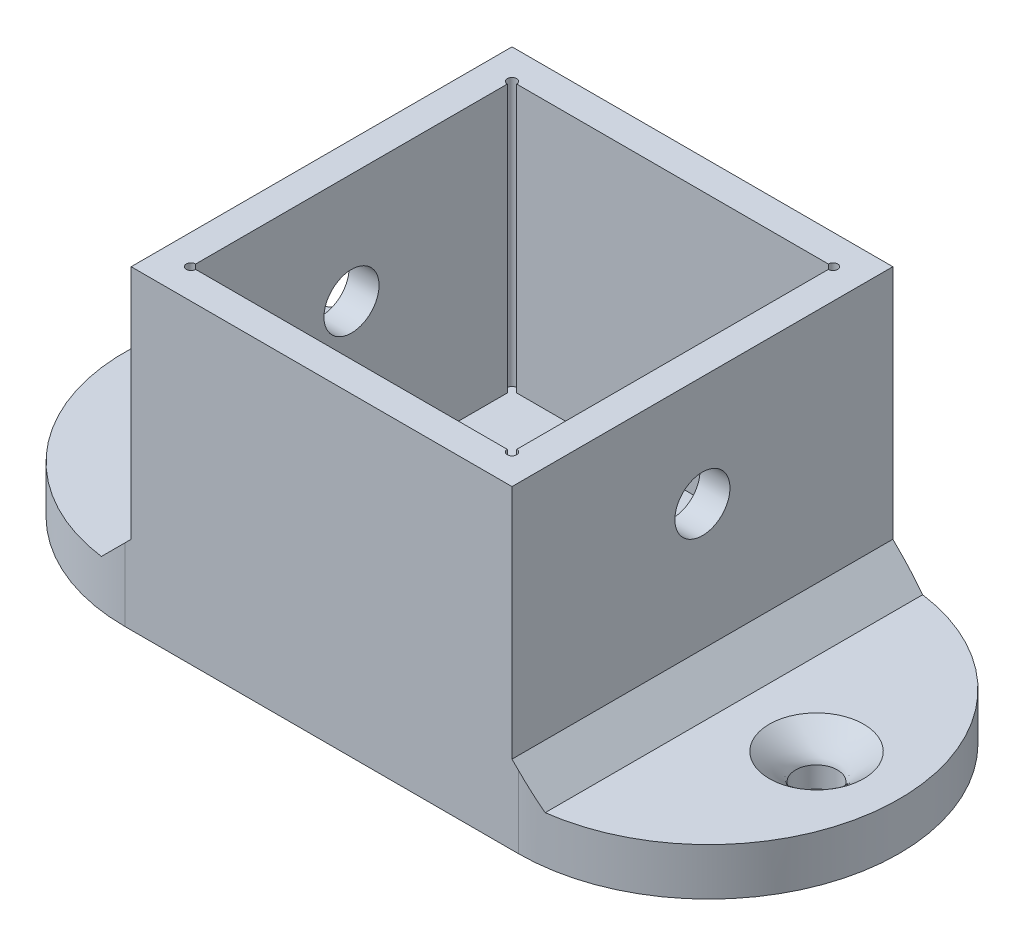
from build123d import *

# Parameters (mm, degrees)
BOSS_EXTRUDE1_DEPTH     = 3.81
SKETCH2_W               = 30.734
SKETCH2_H               = 30.734
SKETCH2_W_2             = 25.908
SKETCH2_H_2             = 25.908
BOSS_EXTRUDE2_DEPTH     = 21.59
CHAMFER1_SIZE           = 2.54
SKETCH3_R               = 1.68275
CUT_EXTRUDE1_DEPTH      = 3.81
CUT_EXTRUDE2_DEPTH      = 54.240878222
CUT_EXTRUDE2_DEPTH_BACK = 54.240878222
SKETCH6_R               = 2.2225
SKETCH8_R               = 0.381
CUT_EXTRUDE3_DEPTH      = 21.59


with BuildPart() as part:
    # Sketch1 → Boss-Extrude1 (new body)
    with BuildSketch(Plane(origin=(0, 0, 0), x_dir=(1, 0, 0), z_dir=(0, 1, 0))):
        with BuildLine():
            Line((-15.875, 15.367), (15.875, 15.367))
            ThreePointArc((15.875, 15.367), (31.242, 0), (15.875, -15.367))
            Line((15.875, -15.367), (-15.875, -15.367))
            ThreePointArc((-15.875, -15.367), (-31.242, 0), (-15.875, 15.367))
        make_face()
    extrude(amount=BOSS_EXTRUDE1_DEPTH)

    # Sketch2 → Boss-Extrude2 (add)
    with BuildSketch(Plane(origin=(0, 3.81, 0), x_dir=(1, 0, 0), z_dir=(0, 1, 0))):
        Rectangle(SKETCH2_W, SKETCH2_H)
        Rectangle(SKETCH2_W_2, SKETCH2_H_2, mode=Mode.SUBTRACT)
    extrude(amount=BOSS_EXTRUDE2_DEPTH)

    # Chamfer1
    chamfer1_edges = [part.edges().sort_by_distance(p)[0] for p in [
        (15.367, 3.81, 0),
        (-15.367, 3.81, 0),
    ]]
    chamfer(chamfer1_edges, length=CHAMFER1_SIZE)

    # Sketch3 → Cut-Extrude1 (cut)
    with BuildSketch(Plane(origin=(0, 3.81, 0), x_dir=(1, 0, 0), z_dir=(0, 1, 0))):
        with Locations(Location((-24.5745, 0, 0), (0, 0, 270))):
            Circle(SKETCH3_R)
        with Locations(Location((24.5745, 0, 0), (0, 0, 270))):
            Circle(SKETCH3_R)
    extrude(amount=-CUT_EXTRUDE1_DEPTH, mode=Mode.SUBTRACT)

    # Cut-Loft1: read off the stored shape, not the designer's step
    # Cut-Loft1: loft between two sections, ruled curve by curve
    cut_loft1_from = [
        Edge.make_bspline([(-26.145987116, 1.27, -0.601727352), (-27.349441821, 1.27, 2.54124688), (-24.206467589, 1.27, 3.744701584), (-23.003012884, 1.27, 0.601727352), (-21.799558179, 1.27, -2.54124688), (-24.942532411, 1.27, -3.744701584), (-26.145987116, 1.27, -0.601727352)], [0, 0, 0, 0, 0.5, 0.5, 0.5, 1, 1, 1, 1], 3, [1, 0.333333333, 0.333333333, 1, 0.333333333, 0.333333333, 1]),
    ]
    cut_loft1_to = [
        Edge.make_bspline([(-24.211181072, 3.81, -3.79263752), (-31.796456111, 3.81, -4.519275376), (-32.523093968, 3.81, 3.065999663), (-24.937818928, 3.81, 3.79263752), (-17.352543889, 3.81, 4.519275376), (-16.625906032, 3.81, -3.065999663), (-24.211181072, 3.81, -3.79263752)], [0, 0, 0, 0, 0.5, 0.5, 0.5, 1, 1, 1, 1], 3, [1, 0.333333333, 0.333333333, 1, 0.333333333, 0.333333333, 1]),
    ]
    cut_loft1 = Solid(Shell([*[Face.make_surface_from_curves(cut_loft1_from[k], cut_loft1_to[k]) for k in range(1)], Face(Wire(cut_loft1_from)), Face(Wire(cut_loft1_to))]))
    add(cut_loft1, mode=Mode.SUBTRACT)

    # Mirror1: Cut-Loft1 across plane
    add(cut_loft1.mirror(Plane(origin=(0, 0, 0), x_dir=(0, 0, 1), z_dir=(1, 0, 0))), mode=Mode.SUBTRACT)

    # Sketch6 → Cut-Extrude2 (cut, two sides: drawn at the far end of the back side and taken through both)
    with BuildSketch(Plane.ZY.offset(-12.954).offset(-CUT_EXTRUDE2_DEPTH_BACK)):
        with Locations(Location((0, 16.51, 0), (0, 0, 180))):
            Circle(SKETCH6_R)
    extrude(amount=CUT_EXTRUDE2_DEPTH + CUT_EXTRUDE2_DEPTH_BACK, mode=Mode.SUBTRACT)

    # Sketch8 → Cut-Extrude3 (cut)
    with BuildSketch(Plane(origin=(0, 25.4, 0), x_dir=(1, 0, 0), z_dir=(0, 1, 0))):
        with Locations((-12.954, 12.954)):
            Circle(SKETCH8_R)
        with Locations((12.954, 12.954)):
            Circle(SKETCH8_R)
        with Locations((12.954, -12.954)):
            Circle(SKETCH8_R)
        with Locations((-12.954, -12.954)):
            Circle(SKETCH8_R)
    extrude(amount=-CUT_EXTRUDE3_DEPTH, mode=Mode.SUBTRACT)


solid = part.part
